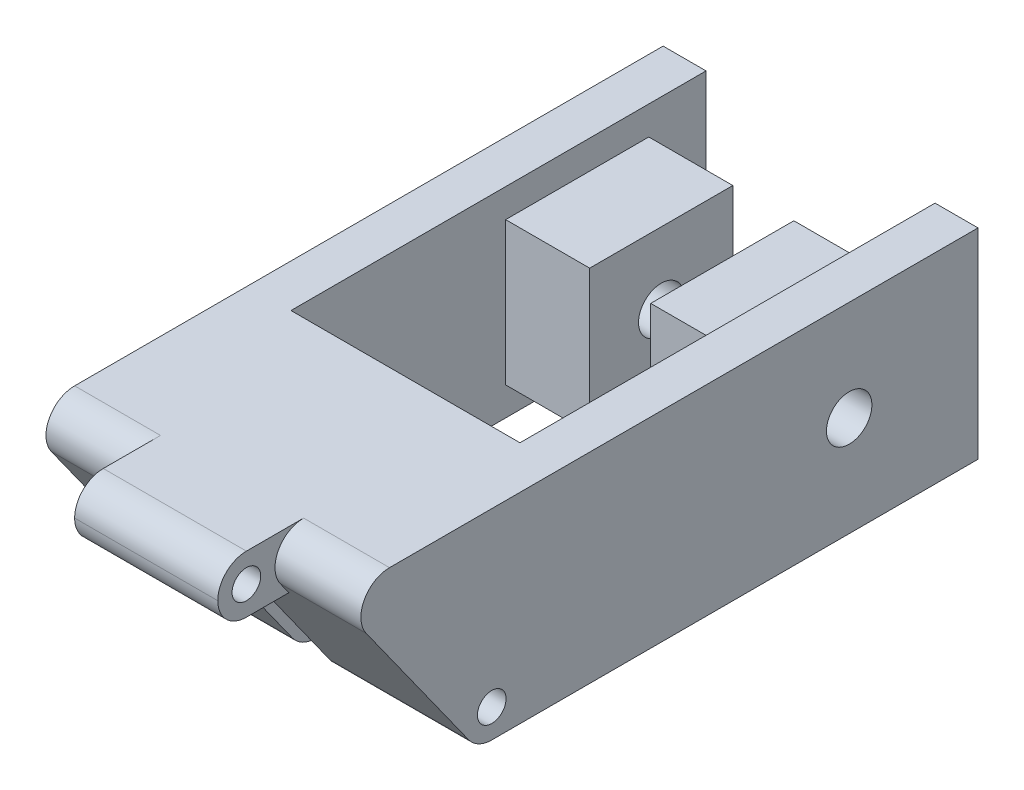
from build123d import *

# Parameters (mm, degrees)
SKETCH1_R              = 1
BOSS_EXTRUDE1_DEPTH    = 11
SKETCH2_W              = 10
SKETCH2_H              = 6
BOSS_EXTRUDE2_DEPTH    = 4
CUT_EXTRUDE1_REACH     = 52.246
SKETCH3_R              = 1
FILLET1_R              = 2
SKETCH4_W              = 2.6
SKETCH4_H              = 8
CUT_EXTRUDE3_DEPTH     = 7
CUT_EXTRUDE4_START     = -8
CUT_EXTRUDE4_OUTLINE_W = 29
CUT_EXTRUDE4_OUTLINE_H = 14
CUT_EXTRUDE4_DEPTH     = 16
SKETCH5_3_R            = 1.5875
CUT_EXTRUDE5_DEPTH     = 12.5
SKETCH7_W              = 10
SKETCH7_H              = 10
SKETCH7_R              = 1.5875
BOSS_EXTRUDE3_DEPTH    = 5.87
BOSS_EXTRUDE4_START    = 5.865
SKETCH9_W              = 10
SKETCH9_H              = 10
SKETCH9_R              = 1.5875
BOSS_EXTRUDE4_DEPTH    = 5.865


# Read off the part's stored shape, not the designer's step: Cut-Extrude4
with BuildPart() as part:
    # Sketch1 → Boss-Extrude1 (new, symmetric)
    with BuildSketch(Plane(origin=(0, 0, 0), x_dir=(0, 0, -1), z_dir=(1, 0, 0))):
        with BuildLine():
            Line((-42.741088295, 3.837523613), (-35.598231152, -6.162476387))
            ThreePointArc((-35.598231152, -6.162476387), (-34.885927371, -6.778335285), (-33.970764209, -7))
            Line((-33.970764209, -7), (0, -7))
            Line((0, -7), (0, 7))
            Line((0, 7), (-41.113621352, 7))
            ThreePointArc((-41.113621352, 7), (-42.891956638, 5.915163162), (-42.741088295, 3.837523613))
        make_face()
        with Locations((-33.970764209, -5)):
            Circle(SKETCH1_R, mode=Mode.SUBTRACT)
    extrude(amount=BOSS_EXTRUDE1_DEPTH, both=True)

    # Sketch2 → Boss-Extrude2 (add)
    with BuildSketch(Plane(origin=(0, 7, 0), x_dir=(1, 0, 0), z_dir=(0, 1, 0))):
        with Locations((0, -44.113621352)):
            Rectangle(SKETCH2_W, SKETCH2_H)
    extrude(amount=-BOSS_EXTRUDE2_DEPTH)

    # Sketch3 → Cut-Extrude1 (cut, up to next)
    with BuildSketch(Plane(origin=(5, 0, 0), x_dir=(0, 0, -1), z_dir=(1, 0, 0)), mode=Mode.PRIVATE) as cut_extrude1_sk1:
        with Locations((-45.113621352, 5)):
            Circle(SKETCH3_R)
    cut_extrude1_tool1 = extrude(cut_extrude1_sk1.sketch, amount=-CUT_EXTRUDE1_REACH, mode=Mode.PRIVATE) & part.part
    add(cut_extrude1_tool1.solids().sort_by_distance((5, 5, 45.113621))[0], mode=Mode.SUBTRACT)

    # Fillet1
    fillet1_edges = [part.edges().sort_by_distance(p)[0] for p in [
        (0, 3, 47.113621352),
        (0, 7, 47.113621352),
    ]]
    fillet(fillet1_edges, radius=FILLET1_R - 0.0001)  # a hair under: the kernel refuses the full size

    # Sketch4 → Cut-Extrude3 (cut)
    with BuildSketch(Plane.XZ.offset(7)):
        with Locations((0, 35.598231152)):
            Rectangle(SKETCH4_W, SKETCH4_H)
    extrude(amount=-CUT_EXTRUDE3_DEPTH, mode=Mode.SUBTRACT)

    # Cut-Extrude4 outline → Cut-Extrude4 (cut)
    with BuildSketch(Plane.ZY.offset(CUT_EXTRUDE4_START)):
        with Locations((14.5, 0)):
            Rectangle(CUT_EXTRUDE4_OUTLINE_W, CUT_EXTRUDE4_OUTLINE_H)
    extrude(amount=CUT_EXTRUDE4_DEPTH, mode=Mode.SUBTRACT)

    # Sketch5<3> → Cut-Extrude5 (cut, symmetric)
    with BuildSketch(Plane.ZY):
        with Locations((9, 0)):
            Circle(SKETCH5_3_R)
    extrude(amount=CUT_EXTRUDE5_DEPTH, both=True, mode=Mode.SUBTRACT)

    # Sketch7 → Boss-Extrude3 (add)
    with BuildSketch(Plane(origin=(-8, 0, 0), x_dir=(0, 0, -1), z_dir=(1, 0, 0))):
        with Locations((-9, 0)):
            Rectangle(SKETCH7_W, SKETCH7_H)
        with Locations(Location((-9, 0, 0), (0, 0, 180))):
            Circle(SKETCH7_R, mode=Mode.SUBTRACT)
    extrude(amount=BOSS_EXTRUDE3_DEPTH)

    # Sketch9 → Boss-Extrude4 (add)
    with BuildSketch(Plane.ZY.offset(-8).offset(BOSS_EXTRUDE4_START)):
        with Locations((9, 0)):
            Rectangle(SKETCH9_W, SKETCH9_H)
        with Locations((9, 0)):
            Circle(SKETCH9_R, mode=Mode.SUBTRACT)
    extrude(amount=-BOSS_EXTRUDE4_DEPTH)


solid = part.part
